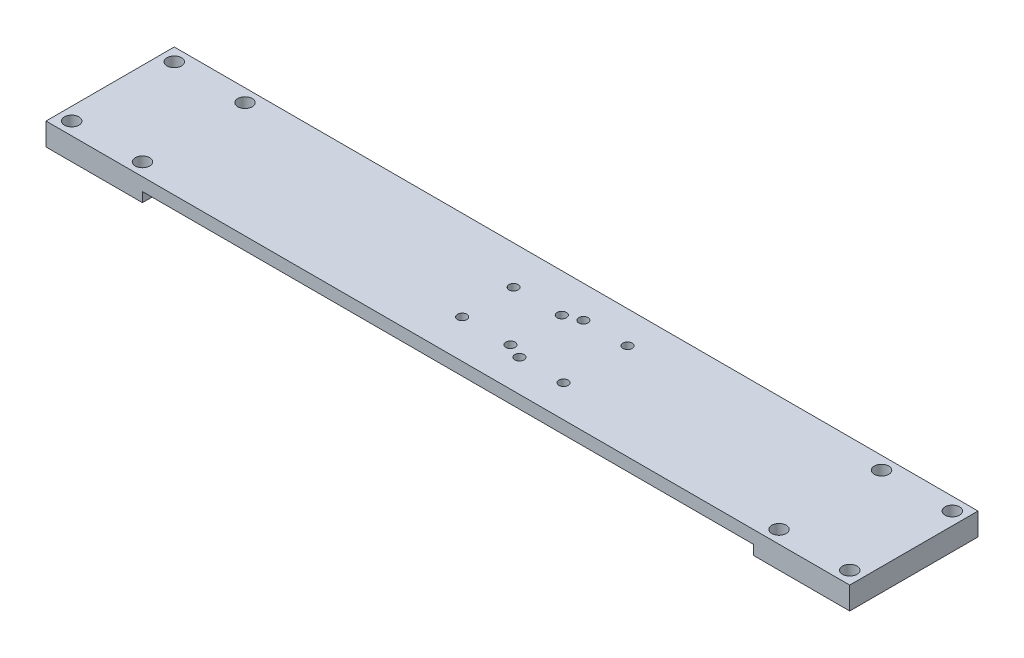
from build123d import *

# Parameters (mm, degrees)
SKETCH_1_W          = 250
SKETCH_1_H          = 39.9
EXTRUDE_1_DEPTH     = 4
SKETCH_2_R          = 1.45
CUT_EXTRUDE_1_DEPTH = 12
SKETCH_3_R          = 1.45
CUT_EXTRUDE_2_DEPTH = 12
SKETCH_7_R          = 2.25
CUT_EXTRUDE_6_DEPTH = 20
SKETCH_8_W          = 30
SKETCH_8_H          = 39.9
SKETCH_8_R          = 2.25
EXTRUDE_2_DEPTH     = 1
SKETCH_9_W          = 30
SKETCH_9_H          = 39.9
EXTRUDE_3_DEPTH     = 2
SKETCH_10_R         = 1.5
CUT_EXTRUDE_7_DEPTH = 3


with BuildPart() as part:
    # 草图1 → 凸台-拉伸1 (new body)
    with BuildSketch(Plane(origin=(0, 0, 0), x_dir=(1, 0, 0), z_dir=(0, 1, 0))):
        with Locations((-125, 19.95)):
            Rectangle(SKETCH_1_W, SKETCH_1_H)
    extrude(amount=EXTRUDE_1_DEPTH)

    # 草图2 → 切除-拉伸1 (cut)
    with BuildSketch(Plane(origin=(0, 4, 0), x_dir=(1, 0, 0), z_dir=(0, 1, 0))):
        with Locations((-132.5, 27.95)):
            Circle(SKETCH_2_R)
        with Locations((-117.5, 27.95)):
            Circle(SKETCH_2_R)
        with Locations((-117.5, 11.95)):
            Circle(SKETCH_2_R)
        with Locations((-132.5, 11.95)):
            Circle(SKETCH_2_R)
    extrude(amount=-CUT_EXTRUDE_1_DEPTH, mode=Mode.SUBTRACT)

    # 草图3 → 切除-拉伸2 (cut)
    with BuildSketch(Plane(origin=(-275.091791604, 0, 148.847510468), x_dir=(-0.9999983055135633, 0, 0.0018409155336922224), z_dir=(0, -1, 0))):
        with Locations((-162.633941367, 158.548383777)):
            Circle(SKETCH_3_R)
        with Locations((-162.670575586, 178.448350057)):
            Circle(SKETCH_3_R)
        with Locations((-176.383918068, 158.523071189)):
            Circle(SKETCH_3_R)
        with Locations((-176.420552287, 178.423037468)):
            Circle(SKETCH_3_R)
    extrude(amount=-CUT_EXTRUDE_2_DEPTH, mode=Mode.SUBTRACT)

    # 草图7 → 切除-拉伸6 (cut)
    with BuildSketch(Plane(origin=(0, 4, 0), x_dir=(1, 0, 0), z_dir=(0, 1, 0))):
        with Locations((-246, 35.9)):
            Circle(SKETCH_7_R)
        with Locations((-224, 35.9)):
            Circle(SKETCH_7_R)
        with Locations((-224, 4)):
            Circle(SKETCH_7_R)
        with Locations((-246, 4)):
            Circle(SKETCH_7_R)
        with Locations((-4, 4)):
            Circle(SKETCH_7_R)
        with Locations((-26, 4)):
            Circle(SKETCH_7_R)
        with Locations((-26, 35.9)):
            Circle(SKETCH_7_R)
        with Locations((-4, 35.9)):
            Circle(SKETCH_7_R)
    extrude(amount=-CUT_EXTRUDE_6_DEPTH, mode=Mode.SUBTRACT)

    # 草图8 → 凸台-拉伸2 (add)
    # profile 1 of 2: a face of its own
    with BuildSketch(Plane.XZ):
        with Locations((-235, -19.95)):
            Rectangle(SKETCH_8_W, SKETCH_8_H)
        with Locations((-224, -35.9)):
            Circle(SKETCH_8_R, mode=Mode.SUBTRACT)
        with Locations((-246, -35.9)):
            Circle(SKETCH_8_R, mode=Mode.SUBTRACT)
        with Locations((-224, -4)):
            Circle(SKETCH_8_R, mode=Mode.SUBTRACT)
        with Locations((-246, -4)):
            Circle(SKETCH_8_R, mode=Mode.SUBTRACT)
    # profile 2 of 2: a face of its own
    with BuildSketch(Plane.XZ):
        with Locations((-15, -19.95)):
            Rectangle(SKETCH_8_W, SKETCH_8_H)
        with Locations((-4, -35.9)):
            Circle(SKETCH_8_R, mode=Mode.SUBTRACT)
        with Locations((-26, -35.9)):
            Circle(SKETCH_8_R, mode=Mode.SUBTRACT)
        with Locations((-4, -4)):
            Circle(SKETCH_8_R, mode=Mode.SUBTRACT)
        with Locations((-26, -4)):
            Circle(SKETCH_8_R, mode=Mode.SUBTRACT)
    extrude(amount=EXTRUDE_2_DEPTH)

    # 草图9 → 凸台-拉伸3 (add)
    with BuildSketch(Plane.XZ.offset(1)):
        with Locations((-15, -19.95)):
            Rectangle(SKETCH_9_W, SKETCH_9_H)
        with Locations((-235, -19.95)):
            Rectangle(SKETCH_9_W, SKETCH_9_H)
    extrude(amount=EXTRUDE_3_DEPTH)

    # 草图10 → 切除-拉伸7 (cut)
    with BuildSketch(Plane(origin=(0, -1, 0), x_dir=(1, 0, 0), z_dir=(0, 1, 0))):
        with Locations((-246, 35.9)):
            Circle(SKETCH_10_R)
        with Locations((-246, 4)):
            Circle(SKETCH_10_R)
        with Locations((-224, 35.9)):
            Circle(SKETCH_10_R)
        with Locations((-224, 4)):
            Circle(SKETCH_10_R)
        with Locations((-26, 35.9)):
            Circle(SKETCH_10_R)
        with Locations((-26, 4)):
            Circle(SKETCH_10_R)
        with Locations((-4, 35.9)):
            Circle(SKETCH_10_R)
        with Locations((-4, 4)):
            Circle(SKETCH_10_R)
    extrude(amount=-CUT_EXTRUDE_7_DEPTH, mode=Mode.SUBTRACT)


solid = part.part
